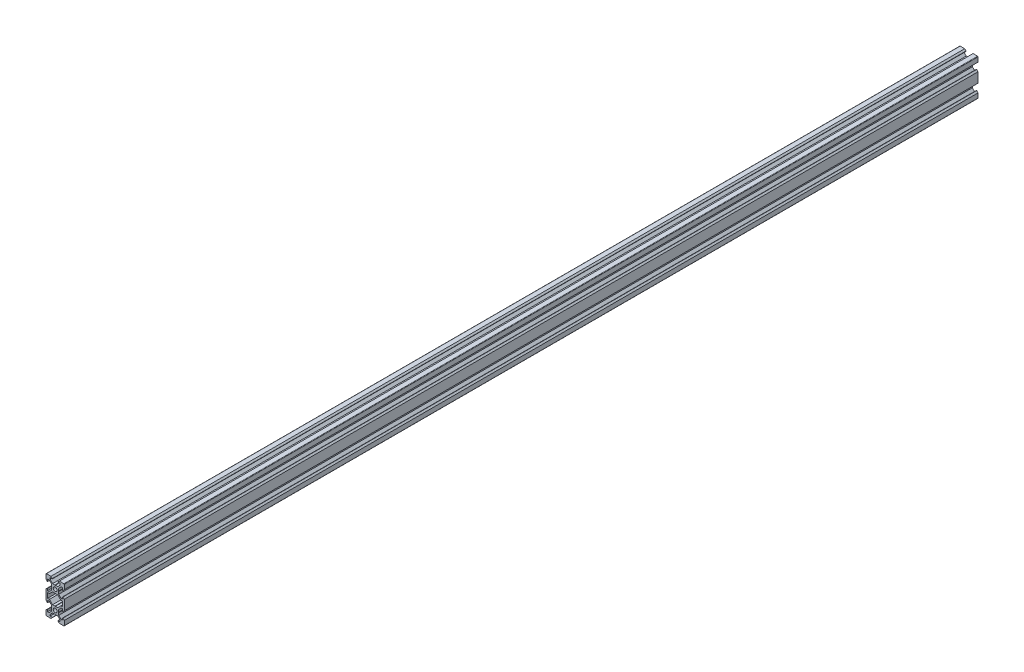
from build123d import *

# Parameters (mm, degrees)
BOSS_EXTRU_1_DEPTH  = 1000
SYM_TRIE6_OUTLINE_R = 2.1
SYM_TRIE6_DEPTH     = 1000


# Read off the part's stored shape, not the designer's step: Symétrie6
with BuildPart() as part:
    # Esquisse1 → Boss.-Extru.1 (new body)
    with BuildSketch(Plane.XY):
        with BuildLine():
            Line((-9.5, 10), (-4.58, 10))
            Line((-4.58, 10), (-3.125, 8.545))
            Line((-3.125, 8.545), (-3.125, 8.2))
            Line((-3.125, 8.2), (-5.5, 8.2))
            Line((-5.5, 8.2), (-5.5, 6.560660172))
            Line((-5.5, 6.560660172), (-2.839339828, 3.9))
            Line((-2.839339828, 3.9), (-0.21, 3.9))
            Line((-0.21, 3.9), (0, 3.69))
            Line((0, 3.69), (0, 2.1))
            ThreePointArc((0, 2.1), (-2.1, 0), (0, -2.1))
            Line((0, -2.1), (0, -3.69))
            Line((0, -3.69), (-0.21, -3.9))
            Line((-0.21, -3.9), (-2.839339828, -3.9))
            Line((-2.839339828, -3.9), (-6.239339828, -7.3))
            Line((-6.239339828, -7.3), (-8.2, -7.3))
            Line((-8.2, -7.3), (-8.2, -10))
            Line((-8.2, -10), (-10, -10))
            Line((-10, -10), (-10, -4.58))
            Line((-10, -4.58), (-8.545, -3.125))
            Line((-8.545, -3.125), (-8.2, -3.125))
            Line((-8.2, -3.125), (-8.2, -5.5))
            Line((-8.2, -5.5), (-6.560660172, -5.5))
            Line((-6.560660172, -5.5), (-3.9, -2.839339828))
            Line((-3.9, -2.839339828), (-3.9, -0.21))
            Line((-3.9, -0.21), (-3.69, 0))
            Line((-3.69, 0), (-3.9, 0.21))
            Line((-3.9, 0.21), (-3.9, 2.839339828))
            Line((-3.9, 2.839339828), (-6.560660172, 5.5))
            Line((-6.560660172, 5.5), (-8.2, 5.5))
            Line((-8.2, 5.5), (-8.2, 3.125))
            Line((-8.2, 3.125), (-8.545, 3.125))
            Line((-8.545, 3.125), (-10, 4.58))
            Line((-10, 4.58), (-10, 9.5))
            ThreePointArc((-10, 9.5), (-9.853553391, 9.853553391), (-9.5, 10))
        make_face()
    boss_extru_1 = extrude(amount=BOSS_EXTRU_1_DEPTH)

    # Symétrie1: Boss.-Extru.1 across Right Plane
    add(boss_extru_1.mirror(Plane(origin=(0, 0, 0), x_dir=(0, 0, -1), z_dir=(1, 0, 0))))

    # Symétrie6 outline → Symétrie6 (add)
    with BuildSketch(Plane.XY):
        with BuildLine():
            Line((-3.9, -17.160660172), (-3.9, -19.79))
            Line((-3.9, -19.79), (-3.69, -20))
            Line((-3.69, -20), (-3.9, -20.21))
            Line((-3.9, -20.21), (-3.9, -22.839339828))
            Line((-3.9, -22.839339828), (-6.560660172, -25.5))
            Line((-6.560660172, -25.5), (-8.2, -25.5))
            Line((-8.2, -25.5), (-8.2, -23.125))
            Line((-8.2, -23.125), (-8.545, -23.125))
            Line((-8.545, -23.125), (-10, -24.58))
            Line((-10, -24.58), (-10, -29.5))
            ThreePointArc((-10, -29.5), (-9.853553391, -29.853553391), (-9.5, -30))
            Line((-9.5, -30), (-4.58, -30))
            Line((-4.58, -30), (-3.125, -28.545))
            Line((-3.125, -28.545), (-3.125, -28.2))
            Line((-3.125, -28.2), (-5.5, -28.2))
            Line((-5.5, -28.2), (-5.5, -26.560660172))
            Line((-5.5, -26.560660172), (-2.839339828, -23.9))
            Line((-2.839339828, -23.9), (-0.21, -23.9))
            Line((-0.21, -23.9), (0, -23.69))
            Line((0, -23.69), (0.21, -23.9))
            Line((0.21, -23.9), (2.839339828, -23.9))
            Line((2.839339828, -23.9), (5.5, -26.560660172))
            Line((5.5, -26.560660172), (5.5, -28.2))
            Line((5.5, -28.2), (3.125, -28.2))
            Line((3.125, -28.2), (3.125, -28.545))
            Line((3.125, -28.545), (4.58, -30))
            Line((4.58, -30), (9.5, -30))
            ThreePointArc((9.5, -30), (9.853553391, -29.853553391), (10, -29.5))
            Line((10, -29.5), (10, -24.58))
            Line((10, -24.58), (8.545, -23.125))
            Line((8.545, -23.125), (8.2, -23.125))
            Line((8.2, -23.125), (8.2, -25.5))
            Line((8.2, -25.5), (6.560660172, -25.5))
            Line((6.560660172, -25.5), (3.9, -22.839339828))
            Line((3.9, -22.839339828), (3.9, -20.21))
            Line((3.9, -20.21), (3.69, -20))
            Line((3.69, -20), (3.9, -19.79))
            Line((3.9, -19.79), (3.9, -17.160660172))
            Line((3.9, -17.160660172), (6.560660172, -14.5))
            Line((6.560660172, -14.5), (8.2, -14.5))
            Line((8.2, -14.5), (8.2, -16.875))
            Line((8.2, -16.875), (8.545, -16.875))
            Line((8.545, -16.875), (10, -15.42))
            Line((10, -15.42), (10, -10))
            Line((10, -10), (8.2, -10))
            Line((8.2, -10), (8.2, -12.7))
            Line((8.2, -12.7), (6.239339828, -12.7))
            Line((6.239339828, -12.7), (2.839339828, -16.1))
            Line((2.839339828, -16.1), (0.21, -16.1))
            Line((0.21, -16.1), (0, -16.31))
            Line((0, -16.31), (-0.21, -16.1))
            Line((-0.21, -16.1), (-2.839339828, -16.1))
            Line((-2.839339828, -16.1), (-6.239339828, -12.7))
            Line((-6.239339828, -12.7), (-8.2, -12.7))
            Line((-8.2, -12.7), (-8.2, -10))
            Line((-8.2, -10), (-10, -10))
            Line((-10, -10), (-10, -15.42))
            Line((-10, -15.42), (-8.545, -16.875))
            Line((-8.545, -16.875), (-8.2, -16.875))
            Line((-8.2, -16.875), (-8.2, -14.5))
            Line((-8.2, -14.5), (-6.560660172, -14.5))
            Line((-6.560660172, -14.5), (-3.9, -17.160660172))
        make_face()
        with Locations((0, -20)):
            Circle(SYM_TRIE6_OUTLINE_R, mode=Mode.SUBTRACT)
    extrude(amount=SYM_TRIE6_DEPTH)


solid = part.part
